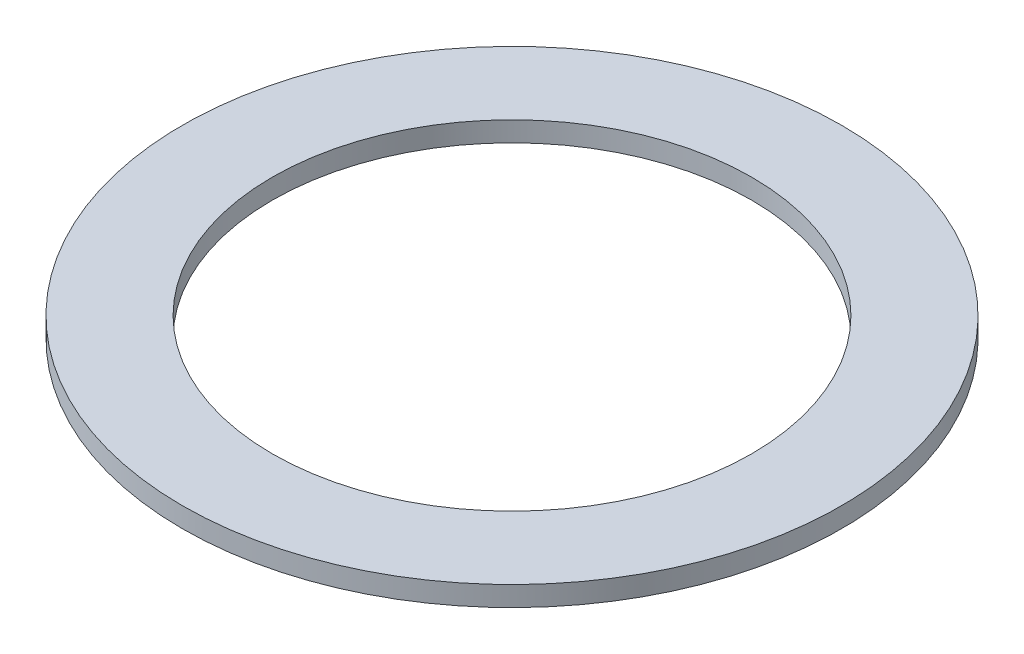
from build123d import *

# Parameters (mm, degrees)
SKETCH2_R           = 16.5
SKETCH2_R_2         = 12
BOSS_EXTRUDE1_DEPTH = 1


with BuildPart() as part:
    # Sketch2 → Boss-Extrude1 (new body)
    with BuildSketch(Plane(origin=(0, 0, 0), x_dir=(1, 0, 0), z_dir=(0, 1, 0))):
        Circle(SKETCH2_R)
        Circle(SKETCH2_R_2, mode=Mode.SUBTRACT)
    extrude(amount=BOSS_EXTRUDE1_DEPTH)


solid = part.part
